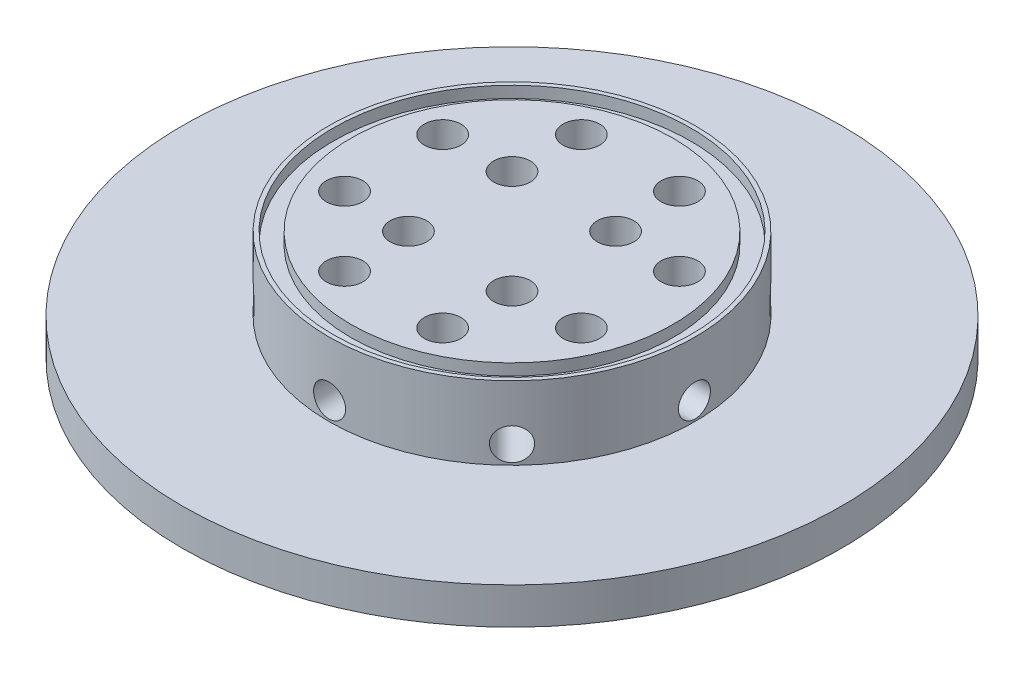
from build123d import *

# Parameters (mm, degrees)
CIRPATTERN1_COUNT = 8
CIRPATTERN2_COUNT = 4
CIRPATTERN4_COUNT = 4
CIRPATTERN6_COUNT = 8


with BuildPart() as part:
    # Sketch1 → Revolve1 (revolve)
    with BuildSketch(Plane.XY, mode=Mode.PRIVATE) as revolve1_sk:
        Polygon((0, 0), (-51.6509, 0), (-51.6509, 2.6924), (-55.7149, 2.6924), (-55.7149, 0), (-57.15, 0), (-57.15, 6.35), (-31.75, 6.35), (-31.75, 19.05), (-31.0261, 19.05), (-31.0261, 17.0688), (-27.9527, 17.0688), (-27.9527, 19.05), (0, 19.05), align=None)
    revolve(revolve1_sk.sketch.rotate(Axis((0, 19.05, 0), (0, -1, 0)), 270), axis=Axis((0, 19.05, 0), (0, -1, 0)))

    # Sketch5 → 1/4 (0.25) Diameter Hole3 (revolve, cut)
    with BuildSketch(Plane(origin=(-8.980256121, 19.05, 8.980256121), x_dir=(0, 0, 1), z_dir=(1, 0, 0))):
        Polygon((0, 0), (0, 14.607732465), (3.175, 12.7), (3.175, 0), align=None)
    f_1_4_0_25_diameter_hole3 = revolve(axis=Axis((-8.980256121, 25.4, 8.980256121), (0, -1, 0)), mode=Mode.SUBTRACT)

    # Sketch15 → 1/4 (0.25) Diameter Hole8 (revolve, cut)
    with BuildSketch(Plane(origin=(-20.53322261, 19.05, 8.505139284), x_dir=(0, 0, 1), z_dir=(1, 0, 0))):
        Polygon((0, 0), (0, 14.607732465), (3.175, 12.7), (3.175, 0), align=None)
    f_1_4_0_25_diameter_hole8 = revolve(axis=Axis((-20.53322261, 25.4, 8.505139284), (0, -1, 0)), mode=Mode.SUBTRACT)

    # CirPattern1: 1/4 (0.25) Diameter Hole8 ×8 about axis
    cirpattern1_axis = Axis((0, 0, 0), (0, 1, 0))
    for i in range(1, CIRPATTERN1_COUNT):
        add(f_1_4_0_25_diameter_hole8.rotate(cirpattern1_axis, i * 360 / CIRPATTERN1_COUNT), mode=Mode.SUBTRACT)

    # CirPattern2: 1/4 (0.25) Diameter Hole3 ×4 about axis
    cirpattern2_axis = Axis((0, 0, 0), (0, 1, 0))
    for i in range(1, CIRPATTERN2_COUNT):
        add(f_1_4_0_25_diameter_hole3.rotate(cirpattern2_axis, i * 360 / CIRPATTERN2_COUNT), mode=Mode.SUBTRACT)

    # Sketch21 → 7/32 (0.21875) Diameter Hole1 (revolve, cut)
    with BuildSketch(Plane(origin=(-57.15, 9.525, 0), x_dir=(0, 0, 1), z_dir=(0, 1, 0))):
        Polygon((0, 0), (0, 39.769265907), (2.778125, 38.1), (2.778125, 0), align=None)
    f_7_32_0_21875_diameter_hole1 = revolve(axis=Axis((-63.5, 9.525, 0), (1, 0, 0)), mode=Mode.SUBTRACT)

    # Sketch13 → 11/64 (0.17188) Diameter Hole1 (revolve, cut)
    with BuildSketch(Plane(origin=(-57.15, 9.525, 0), x_dir=(0, 0, 1), z_dir=(0, 1, 0))):
        Polygon((0, 0), (0, 52.111604225), (2.182876, 50.8), (2.182876, 0), align=None)
    f_11_64_0_17188_diameter_hole1 = revolve(axis=Axis((-63.5, 9.525, 0), (1, 0, 0)), mode=Mode.SUBTRACT)

    # CirPattern4: 11/64 (0.17188) Diameter Hole1 ×4 about axis
    cirpattern4_axis = Axis((0, 19.05, 0), (0, 1, 0))
    for i in range(1, CIRPATTERN4_COUNT):
        add(f_11_64_0_17188_diameter_hole1.rotate(cirpattern4_axis, i * 360 / CIRPATTERN4_COUNT), mode=Mode.SUBTRACT)

    # CirPattern6: 7/32 (0.21875) Diameter Hole1 ×8 about axis
    cirpattern6_axis = Axis((0, 19.05, 0), (0, 1, 0))
    for i in range(1, CIRPATTERN6_COUNT):
        add(f_7_32_0_21875_diameter_hole1.rotate(cirpattern6_axis, i * 360 / CIRPATTERN6_COUNT), mode=Mode.SUBTRACT)

    # Sketch29 → 1/32 (0.03125) Diameter Hole2 (revolve, cut)
    with BuildSketch(Plane(origin=(20.53322261, 0, 0), x_dir=(0, 0, -1), z_dir=(1, 0, 0))):
        Polygon((0, 0), (0, 9.763466558), (0.396875, 9.525), (0.396875, 0), align=None)
    revolve(axis=Axis((20.53322261, -6.35, 0), (0, 1, 0)), mode=Mode.SUBTRACT)

    # Sketch33 → 1/32 (0.03125) Diameter Hole3 (revolve, cut)
    with BuildSketch(Plane(origin=(8.980256121, 0, 0), x_dir=(0, 0, -1), z_dir=(1, 0, 0))):
        Polygon((0, 0), (0, 9.890466558), (0.396875, 9.652), (0.396875, 0), align=None)
    revolve(axis=Axis((8.980256121, -6.35, 0), (0, 1, 0)), mode=Mode.SUBTRACT)

    # Sketch40 → 1/32 (0.03125) Diameter Hole5 (revolve, cut)
    with BuildSketch(Plane(origin=(20.53322261, -3.175, 0), x_dir=(0, -0.6427876096865507, -0.7660444431189686), z_dir=(1, 0, 0))):
        Polygon((0, 0), (0, 12.938466558), (0.396875, 12.7), (0.396875, 0), align=None)
    f_1_32_0_03125_diameter_hole5 = revolve(axis=Axis((20.53322261, -8.039382214, 4.081701322), (0, 0.7660444431189686, -0.6427876096865507)), mode=Mode.SUBTRACT)

    # Mirror2: 1/32 (0.03125) Diameter Hole5 across plane
    add(f_1_32_0_03125_diameter_hole5.mirror(Plane.XY), mode=Mode.SUBTRACT)

    # CirPattern8: read off the stored shape, not the designer's step
    # CirPattern8: loft between two sections, ruled curve by curve
    cirpattern8_from = [
        Edge.make_three_point_arc((14.517742986, 6.775885368, 14.125777493), (14.914617986, 6.775885368, 14.522652493), (14.517742986, 6.775885368, 14.919527493)),
        Edge.make_three_point_arc((14.517742986, 6.775885368, 14.919527493), (14.120867986, 6.775885368, 14.522652493), (14.517742986, 6.775885368, 14.125777493)),
    ]
    cirpattern8_to = [
        Edge.make_three_point_arc((14.517742986, 0, 14.125777493), (14.914617986, 0, 14.522652493), (14.517742986, 0, 14.919527493)),
        Edge.make_three_point_arc((14.517742986, 0, 14.919527493), (14.120867986, 0, 14.522652493), (14.517742986, 0, 14.125777493)),
    ]
    cirpattern8 = Solid(Shell([*[Face.make_surface_from_curves(cirpattern8_from[k], cirpattern8_to[k]) for k in range(2)], Face(Wire(cirpattern8_from)), Face(Wire(cirpattern8_to))]))
    add(cirpattern8, mode=Mode.SUBTRACT)

    # CirPattern8 2: loft between two sections, ruled curve by curve
    cirpattern8_2_from = [
        Edge.make_three_point_arc((-0.004909507, 6.776086761, 20.141257117), (0.391965493, 6.776086761, 20.538132117), (-0.004909507, 6.776086761, 20.935007117)),
        Edge.make_three_point_arc((-0.004909507, 6.776086761, 20.935007117), (-0.401784507, 6.776086761, 20.538132117), (-0.004909507, 6.776086761, 20.141257117)),
    ]
    cirpattern8_2_to = [
        Edge.make_three_point_arc((-0.004909507, 0, 20.141257117), (0.391965493, 0, 20.538132117), (-0.004909507, 0, 20.935007117)),
        Edge.make_three_point_arc((-0.004909507, 0, 20.935007117), (-0.401784507, 0, 20.538132117), (-0.004909507, 0, 20.141257117)),
    ]
    cirpattern8_2 = Solid(Shell([*[Face.make_surface_from_curves(cirpattern8_2_from[k], cirpattern8_2_to[k]) for k in range(2)], Face(Wire(cirpattern8_2_from)), Face(Wire(cirpattern8_2_to))]))
    add(cirpattern8_2, mode=Mode.SUBTRACT)

    # CirPattern8 3: loft between two sections, ruled curve by curve
    cirpattern8_3_from = [
        Edge.make_three_point_arc((-14.527562, 6.775885353, 14.125777493), (-14.130687, 6.775885353, 14.522652493), (-14.527562, 6.775885353, 14.919527493)),
        Edge.make_three_point_arc((-14.527562, 6.775885353, 14.919527493), (-14.924437, 6.775885353, 14.522652493), (-14.527562, 6.775885353, 14.125777493)),
    ]
    cirpattern8_3_to = [
        Edge.make_three_point_arc((-14.527562, 0, 14.125777493), (-14.130687, 0, 14.522652493), (-14.527562, 0, 14.919527493)),
        Edge.make_three_point_arc((-14.527562, 0, 14.919527493), (-14.924437, 0, 14.522652493), (-14.527562, 0, 14.125777493)),
    ]
    cirpattern8_3 = Solid(Shell([*[Face.make_surface_from_curves(cirpattern8_3_from[k], cirpattern8_3_to[k]) for k in range(2)], Face(Wire(cirpattern8_3_from)), Face(Wire(cirpattern8_3_to))]))
    add(cirpattern8_3, mode=Mode.SUBTRACT)

    # CirPattern8 4: loft between two sections, ruled curve by curve
    cirpattern8_4_from = [
        Edge.make_three_point_arc((-20.543041624, 6.775384855, -0.396875), (-20.146166624, 6.775384855, 0), (-20.543041624, 6.775384855, 0.396875)),
        Edge.make_three_point_arc((-20.543041624, 6.775384855, 0.396875), (-20.939916624, 6.775384855, 0), (-20.543041624, 6.775384855, -0.396875)),
    ]
    cirpattern8_4_to = [
        Edge.make_three_point_arc((-20.543041624, 0, -0.396875), (-20.146166624, 0, 0), (-20.543041624, 0, 0.396875)),
        Edge.make_three_point_arc((-20.543041624, 0, 0.396875), (-20.939916624, 0, 0), (-20.543041624, 0, -0.396875)),
    ]
    cirpattern8_4 = Solid(Shell([*[Face.make_surface_from_curves(cirpattern8_4_from[k], cirpattern8_4_to[k]) for k in range(2)], Face(Wire(cirpattern8_4_from)), Face(Wire(cirpattern8_4_to))]))
    add(cirpattern8_4, mode=Mode.SUBTRACT)

    # CirPattern8 5: loft between two sections, ruled curve by curve
    cirpattern8_5_from = [
        Edge.make_three_point_arc((-14.527562, 6.775885368, -14.919527493), (-14.130687, 6.775885368, -14.522652493), (-14.527562, 6.775885368, -14.125777493)),
        Edge.make_three_point_arc((-14.527562, 6.775885368, -14.125777493), (-14.924437, 6.775885368, -14.522652493), (-14.527562, 6.775885368, -14.919527493)),
    ]
    cirpattern8_5_to = [
        Edge.make_three_point_arc((-14.527562, 0, -14.919527493), (-14.130687, 0, -14.522652493), (-14.527562, 0, -14.125777493)),
        Edge.make_three_point_arc((-14.527562, 0, -14.125777493), (-14.924437, 0, -14.522652493), (-14.527562, 0, -14.919527493)),
    ]
    cirpattern8_5 = Solid(Shell([*[Face.make_surface_from_curves(cirpattern8_5_from[k], cirpattern8_5_to[k]) for k in range(2)], Face(Wire(cirpattern8_5_from)), Face(Wire(cirpattern8_5_to))]))
    add(cirpattern8_5, mode=Mode.SUBTRACT)

    # CirPattern8 6: loft between two sections, ruled curve by curve
    cirpattern8_6_from = [
        Edge.make_three_point_arc((-0.004909507, 6.776086761, -20.935007117), (0.391965493, 6.776086761, -20.538132117), (-0.004909507, 6.776086761, -20.141257117)),
        Edge.make_three_point_arc((-0.004909507, 6.776086761, -20.141257117), (-0.401784507, 6.776086761, -20.538132117), (-0.004909507, 6.776086761, -20.935007117)),
    ]
    cirpattern8_6_to = [
        Edge.make_three_point_arc((-0.004909507, 0, -20.935007117), (0.391965493, 0, -20.538132117), (-0.004909507, 0, -20.141257117)),
        Edge.make_three_point_arc((-0.004909507, 0, -20.141257117), (-0.401784507, 0, -20.538132117), (-0.004909507, 0, -20.935007117)),
    ]
    cirpattern8_6 = Solid(Shell([*[Face.make_surface_from_curves(cirpattern8_6_from[k], cirpattern8_6_to[k]) for k in range(2)], Face(Wire(cirpattern8_6_from)), Face(Wire(cirpattern8_6_to))]))
    add(cirpattern8_6, mode=Mode.SUBTRACT)

    # CirPattern8 7: loft between two sections, ruled curve by curve
    cirpattern8_7_from = [
        Edge.make_three_point_arc((14.517742986, 6.775885353, -14.919527493), (14.914617986, 6.775885353, -14.522652493), (14.517742986, 6.775885353, -14.125777493)),
        Edge.make_three_point_arc((14.517742986, 6.775885353, -14.125777493), (14.120867986, 6.775885353, -14.522652493), (14.517742986, 6.775885353, -14.919527493)),
    ]
    cirpattern8_7_to = [
        Edge.make_three_point_arc((14.517742986, 0, -14.919527493), (14.914617986, 0, -14.522652493), (14.517742986, 0, -14.125777493)),
        Edge.make_three_point_arc((14.517742986, 0, -14.125777493), (14.120867986, 0, -14.522652493), (14.517742986, 0, -14.919527493)),
    ]
    cirpattern8_7 = Solid(Shell([*[Face.make_surface_from_curves(cirpattern8_7_from[k], cirpattern8_7_to[k]) for k in range(2)], Face(Wire(cirpattern8_7_from)), Face(Wire(cirpattern8_7_to))]))
    add(cirpattern8_7, mode=Mode.SUBTRACT)

    # CirPattern8 8: loft between two sections, ruled curve by curve
    cirpattern8_8_from = [
        Edge.make_three_point_arc((9.684186011, 5.589475263, 19.355706854), (9.749841661, 5.334368931, 19.851317211), (9.254231305, 5.079262598, 19.78566156)),
        Edge.make_three_point_arc((9.254231305, 5.079262598, 19.78566156), (9.188575654, 5.334368931, 19.290051203), (9.684186011, 5.589475263, 19.355706854)),
    ]
    cirpattern8_8_to = [
        Edge.make_three_point_arc((13.000684672, -0.000131992, 16.039208193), (13.066340323, -0.255238325, 16.53481855), (12.570729966, -0.510344657, 16.469162899)),
        Edge.make_three_point_arc((12.570729966, -0.510344657, 16.469162899), (12.505074315, -0.255238325, 15.973552542), (13.000684672, -0.000131992, 16.039208193)),
    ]
    cirpattern8_8 = Solid(Shell([*[Face.make_surface_from_curves(cirpattern8_8_from[k], cirpattern8_8_to[k]) for k in range(2)], Face(Wire(cirpattern8_8_from)), Face(Wire(cirpattern8_8_to))]))
    add(cirpattern8_8, mode=Mode.SUBTRACT)

    # CirPattern8 9: loft between two sections, ruled curve by curve
    cirpattern8_9_from = [
        Edge.make_three_point_arc((-6.839672165, 5.589226941, 20.536918699), (-7.143696054, 5.334120609, 20.933793699), (-7.447719942, 5.079014276, 20.536918699)),
        Edge.make_three_point_arc((-7.447719942, 5.079014276, 20.536918699), (-7.143696054, 5.334120609, 20.140043699), (-6.839672165, 5.589226941, 20.536918699)),
    ]
    cirpattern8_9_to = [
        Edge.make_three_point_arc((-2.149643146, -0.000131992, 20.536918699), (-2.453667034, -0.255238325, 20.933793699), (-2.757690922, -0.510344657, 20.536918699)),
        Edge.make_three_point_arc((-2.757690922, -0.510344657, 20.536918699), (-2.453667034, -0.255238325, 20.140043699), (-2.149643146, -0.000131992, 20.536918699)),
    ]
    cirpattern8_9 = Solid(Shell([*[Face.make_surface_from_curves(cirpattern8_9_from[k], cirpattern8_9_to[k]) for k in range(2)], Face(Wire(cirpattern8_9_from)), Face(Wire(cirpattern8_9_to))]))
    add(cirpattern8_9, mode=Mode.SUBTRACT)

    # CirPattern8 10: loft between two sections, ruled curve by curve
    cirpattern8_10_from = [
        Edge.make_three_point_arc((-19.78913645, 5.079637066, 9.257262739), (-19.293630335, 5.335145719, 9.192389399), (-19.360068133, 5.589849095, 9.688102764)),
        Edge.make_three_point_arc((-19.360068133, 5.589849095, 9.688102764), (-19.855574248, 5.334340443, 9.752976104), (-19.78913645, 5.079637066, 9.257262739)),
    ]
    cirpattern8_10_to = [
        Edge.make_three_point_arc((-16.472415793, -0.510344339, 12.573983395), (-15.976909679, -0.254835687, 12.509110056), (-16.043347477, -0.00013231, 13.00482342)),
        Edge.make_three_point_arc((-16.043347477, -0.00013231, 13.00482342), (-16.538853591, -0.255640963, 13.06969676), (-16.472415793, -0.510344339, 12.573983395)),
    ]
    cirpattern8_10 = Solid(Shell([*[Face.make_surface_from_curves(cirpattern8_10_from[k], cirpattern8_10_to[k]) for k in range(2)], Face(Wire(cirpattern8_10_from)), Face(Wire(cirpattern8_10_to))]))
    add(cirpattern8_10, mode=Mode.SUBTRACT)

    # CirPattern8 11: loft between two sections, ruled curve by curve
    cirpattern8_11_from = [
        Edge.make_three_point_arc((-20.533222591, 5.080790438, -7.445424353), (-20.143808638, 5.340604127, -7.135790455), (-20.548006985, 5.590914592, -6.83748206)),
        Edge.make_three_point_arc((-20.548006985, 5.590914592, -6.83748206), (-20.937420939, 5.331100902, -7.147115958), (-20.533222591, 5.080790438, -7.445424353)),
    ]
    cirpattern8_11_to = [
        Edge.make_three_point_arc((-20.533222591, -0.510300402, -2.753942092), (-20.143808638, -0.250486712, -2.444308193), (-20.548006985, -0.000176248, -2.145999798)),
        Edge.make_three_point_arc((-20.548006985, -0.000176248, -2.145999798), (-20.937420939, -0.259989937, -2.455633696), (-20.533222591, -0.510300402, -2.753942092)),
    ]
    cirpattern8_11 = Solid(Shell([*[Face.make_surface_from_curves(cirpattern8_11_from[k], cirpattern8_11_to[k]) for k in range(2)], Face(Wire(cirpattern8_11_from)), Face(Wire(cirpattern8_11_to))]))
    add(cirpattern8_11, mode=Mode.SUBTRACT)

    # CirPattern8 12: loft between two sections, ruled curve by curve
    cirpattern8_12_from = [
        Edge.make_three_point_arc((-9.767955744, 5.351825661, -19.839621896), (-9.277070043, 5.082143787, -19.803256433), (-9.18235194, 5.32178971, -19.304640506)),
        Edge.make_three_point_arc((-9.18235194, 5.32178971, -19.304640506), (-9.67323764, 5.591471584, -19.341005968), (-9.767955744, 5.351825661, -19.839621896)),
    ]
    cirpattern8_12_to = [
        Edge.make_three_point_arc((-13.085901399, -0.240220349, -16.521676241), (-12.595015699, -0.509902223, -16.485310778), (-12.500297595, -0.2702563, -15.98669485)),
        Edge.make_three_point_arc((-12.500297595, -0.2702563, -15.98669485), (-12.991183295, -0.000574426, -16.023060313), (-13.085901399, -0.240220349, -16.521676241)),
    ]
    cirpattern8_12 = Solid(Shell([*[Face.make_surface_from_curves(cirpattern8_12_from[k], cirpattern8_12_to[k]) for k in range(2)], Face(Wire(cirpattern8_12_from)), Face(Wire(cirpattern8_12_to))]))
    add(cirpattern8_12, mode=Mode.SUBTRACT)

    # CirPattern8 13: loft between two sections, ruled curve by curve
    cirpattern8_13_from = [
        Edge.make_three_point_arc((6.859631941, 5.571258904, -20.694215889), (7.259254151, 5.235936055, -20.901291255), (7.417883085, 5.102830576, -20.379621509)),
        Edge.make_three_point_arc((7.417883085, 5.102830576, -20.379621509), (7.018260874, 5.438153425, -20.172546143), (6.859631941, 5.571258904, -20.694215889)),
    ]
    cirpattern8_13_to = [
        Edge.make_three_point_arc((2.167149284, -0.02102416, -20.694215889), (2.566771494, -0.35634701, -20.901291255), (2.725400428, -0.489452489, -20.379621509)),
        Edge.make_three_point_arc((2.725400428, -0.489452489, -20.379621509), (2.325778217, -0.15412964, -20.172546143), (2.167149284, -0.02102416, -20.694215889)),
    ]
    cirpattern8_13 = Solid(Shell([*[Face.make_surface_from_curves(cirpattern8_13_from[k], cirpattern8_13_to[k]) for k in range(2)], Face(Wire(cirpattern8_13_from)), Face(Wire(cirpattern8_13_to))]))
    add(cirpattern8_13, mode=Mode.SUBTRACT)

    # CirPattern8 14: loft between two sections, ruled curve by curve
    cirpattern8_14_from = [
        Edge.make_three_point_arc((19.353237318, 5.591542488, -9.686655547), (19.848847674, 5.336436156, -9.752311198), (19.783192024, 5.081329823, -9.256700841)),
        Edge.make_three_point_arc((19.783192024, 5.081329823, -9.256700841), (19.287581667, 5.336436156, -9.19104519), (19.353237318, 5.591542488, -9.686655547)),
    ]
    cirpattern8_14_to = [
        Edge.make_three_point_arc((16.035512104, -0.000131992, -13.004380761), (16.53112246, -0.255238325, -13.070036412), (16.46546681, -0.510344657, -12.574426055)),
        Edge.make_three_point_arc((16.46546681, -0.510344657, -12.574426055), (15.969856453, -0.255238325, -12.508770404), (16.035512104, -0.000131992, -13.004380761)),
    ]
    cirpattern8_14 = Solid(Shell([*[Face.make_surface_from_curves(cirpattern8_14_from[k], cirpattern8_14_to[k]) for k in range(2)], Face(Wire(cirpattern8_14_from)), Face(Wire(cirpattern8_14_to))]))
    add(cirpattern8_14, mode=Mode.SUBTRACT)

    # CirPattern8 15: loft between two sections, ruled curve by curve
    cirpattern8_15_from = [
        Edge.make_three_point_arc((19.275518394, 5.35124027, 9.203666963), (19.766301462, 5.081299609, 9.239493637), (19.861549926, 5.320653994, 9.738148567)),
        Edge.make_three_point_arc((19.861549926, 5.320653994, 9.738148567), (19.370766858, 5.590594654, 9.702321894), (19.275518394, 5.35124027, 9.203666963)),
    ]
    cirpattern8_15_to = [
        Edge.make_three_point_arc((15.958083334, -0.239945187, 12.521102023), (16.448866402, -0.509885847, 12.556928697), (16.544114866, -0.270531463, 13.055583627)),
        Edge.make_three_point_arc((16.544114866, -0.270531463, 13.055583627), (16.053331798, -0.000590802, 13.019756954), (15.958083334, -0.239945187, 12.521102023)),
    ]
    cirpattern8_15 = Solid(Shell([*[Face.make_surface_from_curves(cirpattern8_15_from[k], cirpattern8_15_to[k]) for k in range(2)], Face(Wire(cirpattern8_15_from)), Face(Wire(cirpattern8_15_to))]))
    add(cirpattern8_15, mode=Mode.SUBTRACT)

    # CirPattern8 16: loft between two sections, ruled curve by curve
    cirpattern8_16_from = [
        Edge.make_three_point_arc((6.860705201, 5.570488792, 20.378368488), (7.260272353, 5.235212142, 20.171112148), (7.419039921, 5.101990335, 20.692710021)),
        Edge.make_three_point_arc((7.419039921, 5.101990335, 20.692710021), (7.019472769, 5.437266985, 20.89996636), (6.860705201, 5.570488792, 20.378368488)),
    ]
    cirpattern8_16_to = [
        Edge.make_three_point_arc((2.168898168, -0.020989096, 20.378368488), (2.56846532, -0.356265746, 20.171112148), (2.727232887, -0.489487553, 20.692710021)),
        Edge.make_three_point_arc((2.727232887, -0.489487553, 20.692710021), (2.327665735, -0.154210903, 20.89996636), (2.168898168, -0.020989096, 20.378368488)),
    ]
    cirpattern8_16 = Solid(Shell([*[Face.make_surface_from_curves(cirpattern8_16_from[k], cirpattern8_16_to[k]) for k in range(2)], Face(Wire(cirpattern8_16_from)), Face(Wire(cirpattern8_16_to))]))
    add(cirpattern8_16, mode=Mode.SUBTRACT)

    # CirPattern8 17: loft between two sections, ruled curve by curve
    cirpattern8_17_from = [
        Edge.make_three_point_arc((-9.686002719, 5.59114085, 19.354203239), (-9.190806281, 5.334467618, 19.291602351), (-9.259514202, 5.080937869, 19.787607814)),
        Edge.make_three_point_arc((-9.259514202, 5.080937869, 19.787607814), (-9.75471064, 5.337611102, 19.850208701), (-9.686002719, 5.59114085, 19.354203239)),
    ]
    cirpattern8_17_to = [
        Edge.make_three_point_arc((-13.003492501, -0.000136834, 16.036713456), (-12.508296063, -0.256810066, 15.974112569), (-12.577003985, -0.510339815, 16.470118032)),
        Edge.make_three_point_arc((-12.577003985, -0.510339815, 16.470118032), (-13.072200422, -0.253666583, 16.532718919), (-13.003492501, -0.000136834, 16.036713456)),
    ]
    cirpattern8_17 = Solid(Shell([*[Face.make_surface_from_curves(cirpattern8_17_from[k], cirpattern8_17_to[k]) for k in range(2)], Face(Wire(cirpattern8_17_from)), Face(Wire(cirpattern8_17_to))]))
    add(cirpattern8_17, mode=Mode.SUBTRACT)

    # CirPattern8 18: loft between two sections, ruled curve by curve
    cirpattern8_18_from = [
        Edge.make_three_point_arc((-20.537444672, 5.590564012, 6.837509238), (-20.140569672, 5.335457679, 7.141533127), (-20.537444672, 5.080351347, 7.445557015)),
        Edge.make_three_point_arc((-20.537444672, 5.080351347, 7.445557015), (-20.934319672, 5.335457679, 7.141533127), (-20.537444672, 5.590564012, 6.837509238)),
    ]
    cirpattern8_18_to = [
        Edge.make_three_point_arc((-20.537444672, -0.000131992, 2.146358283), (-20.140569672, -0.255238325, 2.450382172), (-20.537444672, -0.510344657, 2.75440606)),
        Edge.make_three_point_arc((-20.537444672, -0.510344657, 2.75440606), (-20.934319672, -0.255238325, 2.450382172), (-20.537444672, -0.000131992, 2.146358283)),
    ]
    cirpattern8_18 = Solid(Shell([*[Face.make_surface_from_curves(cirpattern8_18_from[k], cirpattern8_18_to[k]) for k in range(2)], Face(Wire(cirpattern8_18_from)), Face(Wire(cirpattern8_18_to))]))
    add(cirpattern8_18, mode=Mode.SUBTRACT)

    # CirPattern8 19: loft between two sections, ruled curve by curve
    cirpattern8_19_from = [
        Edge.make_three_point_arc((-19.357120762, 5.589944295, -9.686131998), (-19.291465111, 5.334837963, -9.190521641), (-19.787075468, 5.07973163, -9.256177292)),
        Edge.make_three_point_arc((-19.787075468, 5.07973163, -9.256177292), (-19.852731119, 5.334837963, -9.751787649), (-19.357120762, 5.589944295, -9.686131998)),
    ]
    cirpattern8_19_to = [
        Edge.make_three_point_arc((-16.040343808, -0.000131992, -13.002908952), (-15.974688158, -0.255238325, -12.507298595), (-16.470298515, -0.510344657, -12.572954245)),
        Edge.make_three_point_arc((-16.470298515, -0.510344657, -12.572954245), (-16.535954165, -0.255238325, -13.068564602), (-16.040343808, -0.000131992, -13.002908952)),
    ]
    cirpattern8_19 = Solid(Shell([*[Face.make_surface_from_curves(cirpattern8_19_from[k], cirpattern8_19_to[k]) for k in range(2)], Face(Wire(cirpattern8_19_from)), Face(Wire(cirpattern8_19_to))]))
    add(cirpattern8_19, mode=Mode.SUBTRACT)

    # CirPattern8 20: loft between two sections, ruled curve by curve
    cirpattern8_20_from = [
        Edge.make_three_point_arc((-6.838647048, 5.589649213, -20.535128027), (-7.142670936, 5.33454288, -20.138253027), (-7.446694825, 5.079436547, -20.535128027)),
        Edge.make_three_point_arc((-7.446694825, 5.079436547, -20.535128027), (-7.142670936, 5.33454288, -20.932003027), (-6.838647048, 5.589649213, -20.535128027)),
    ]
    cirpattern8_20_to = [
        Edge.make_three_point_arc((-2.148263701, -0.000131992, -20.535128027), (-2.452287589, -0.255238325, -20.138253027), (-2.756311477, -0.510344657, -20.535128027)),
        Edge.make_three_point_arc((-2.756311477, -0.510344657, -20.535128027), (-2.452287589, -0.255238325, -20.932003027), (-2.148263701, -0.000131992, -20.535128027)),
    ]
    cirpattern8_20 = Solid(Shell([*[Face.make_surface_from_curves(cirpattern8_20_from[k], cirpattern8_20_to[k]) for k in range(2)], Face(Wire(cirpattern8_20_from)), Face(Wire(cirpattern8_20_to))]))
    add(cirpattern8_20, mode=Mode.SUBTRACT)

    # CirPattern8 21: loft between two sections, ruled curve by curve
    cirpattern8_21_from = [
        Edge.make_three_point_arc((9.254292921, 5.079640091, -19.784671239), (9.749911058, 5.334716179, -19.850385644), (9.684314163, 5.589852753, -19.354783075)),
        Edge.make_three_point_arc((9.684314163, 5.589852753, -19.354783075), (9.188696026, 5.334776665, -19.289068669), (9.254292921, 5.079640091, -19.784671239)),
    ]
    cirpattern8_21_to = [
        Edge.make_three_point_arc((12.57101556, -0.510344655, -16.4679486), (13.066633697, -0.255268568, -16.533663005), (13.001036802, -0.000131994, -16.038060435)),
        Edge.make_three_point_arc((13.001036802, -0.000131994, -16.038060435), (12.505418665, -0.255208082, -15.97234603), (12.57101556, -0.510344655, -16.4679486)),
    ]
    cirpattern8_21 = Solid(Shell([*[Face.make_surface_from_curves(cirpattern8_21_from[k], cirpattern8_21_to[k]) for k in range(2)], Face(Wire(cirpattern8_21_from)), Face(Wire(cirpattern8_21_to))]))
    add(cirpattern8_21, mode=Mode.SUBTRACT)

    # Sketch43 → 1/32 (0.03125) Diameter Hole6 (revolve, cut)
    with BuildSketch(Plane(origin=(8.980256121, -3.175, 0), x_dir=(0, -0.5735764363510585, -0.8191520442889831), z_dir=(1, 0, 0))):
        Polygon((0, 0), (0, 12.938466558), (0.396875, 12.7), (0.396875, 0), align=None)
    f_1_32_0_03125_diameter_hole6 = revolve(axis=Axis((8.980256121, -8.376615481, 3.642210371), (0, 0.8191520442889832, -0.5735764363510585)), mode=Mode.SUBTRACT)

    # Mirror3: 1/32 (0.03125) Diameter Hole6 across plane
    add(f_1_32_0_03125_diameter_hole6.mirror(Plane.XY), mode=Mode.SUBTRACT)

    # CirPattern9: read off the stored shape, not the designer's step
    # CirPattern9: loft between two sections, ruled curve by curve
    cirpattern9_from = [
        Edge.make_three_point_arc((-0.001822199, 7.378848939, 8.585203066), (0.395052801, 7.378848939, 8.982078066), (-0.001822199, 7.378848939, 9.378953066)),
        Edge.make_three_point_arc((-0.001822199, 7.378848939, 9.378953066), (-0.398697199, 7.378848939, 8.982078066), (-0.001822199, 7.378848939, 8.585203066)),
    ]
    cirpattern9_to = [
        Edge.make_three_point_arc((-0.001822199, 0, 8.585203066), (0.395052801, 0, 8.982078066), (-0.001822199, 0, 9.378953066)),
        Edge.make_three_point_arc((-0.001822199, 0, 9.378953066), (-0.398697199, 0, 8.982078066), (-0.001822199, 0, 8.585203066)),
    ]
    cirpattern9 = Solid(Shell([*[Face.make_surface_from_curves(cirpattern9_from[k], cirpattern9_to[k]) for k in range(2)], Face(Wire(cirpattern9_from)), Face(Wire(cirpattern9_to))]))
    add(cirpattern9, mode=Mode.SUBTRACT)

    # CirPattern9 2: loft between two sections, ruled curve by curve
    cirpattern9_2_from = [
        Edge.make_three_point_arc((-8.983900264, 7.378525626, -0.396875254), (-8.587025264, 7.378525626, -2.54e-07), (-8.983900264, 7.378525626, 0.396874746)),
        Edge.make_three_point_arc((-8.983900264, 7.378525626, 0.396874746), (-9.380775264, 7.378525626, -2.54e-07), (-8.983900264, 7.378525626, -0.396875254)),
    ]
    cirpattern9_2_to = [
        Edge.make_three_point_arc((-8.983900264, 0, -0.396875254), (-8.587025264, 0, -2.54e-07), (-8.983900264, 0, 0.396874746)),
        Edge.make_three_point_arc((-8.983900264, 0, 0.396874746), (-9.380775264, 0, -2.54e-07), (-8.983900264, 0, -0.396875254)),
    ]
    cirpattern9_2 = Solid(Shell([*[Face.make_surface_from_curves(cirpattern9_2_from[k], cirpattern9_2_to[k]) for k in range(2)], Face(Wire(cirpattern9_2_from)), Face(Wire(cirpattern9_2_to))]))
    add(cirpattern9_2, mode=Mode.SUBTRACT)

    # CirPattern9 3: loft between two sections, ruled curve by curve
    cirpattern9_3_from = [
        Edge.make_three_point_arc((-0.001821945, 7.378848892, -9.37895332), (0.395053055, 7.378848892, -8.98207832), (-0.001821945, 7.378848892, -8.58520332)),
        Edge.make_three_point_arc((-0.001821945, 7.378848892, -8.58520332), (-0.398696945, 7.378848892, -8.98207832), (-0.001821945, 7.378848892, -9.37895332)),
    ]
    cirpattern9_3_to = [
        Edge.make_three_point_arc((-0.001821945, 0, -9.37895332), (0.395053055, 0, -8.98207832), (-0.001821945, 0, -8.58520332)),
        Edge.make_three_point_arc((-0.001821945, 0, -8.58520332), (-0.398696945, 0, -8.98207832), (-0.001821945, 0, -9.37895332)),
    ]
    cirpattern9_3 = Solid(Shell([*[Face.make_surface_from_curves(cirpattern9_3_from[k], cirpattern9_3_to[k]) for k in range(2)], Face(Wire(cirpattern9_3_from)), Face(Wire(cirpattern9_3_to))]))
    add(cirpattern9_3, mode=Mode.SUBTRACT)

    # CirPattern9 4: loft between two sections, ruled curve by curve
    cirpattern9_4_from = [
        Edge.make_three_point_arc((-6.105791087, 6.23506039, 8.981546649), (-6.430892054, 6.007422241, 9.378421649), (-6.755993022, 5.779784093, 8.981546649)),
        Edge.make_three_point_arc((-6.755993022, 5.779784093, 8.981546649), (-6.430892054, 6.007422241, 8.584671649), (-6.105791087, 6.23506039, 8.981546649)),
    ]
    cirpattern9_4_to = [
        Edge.make_three_point_arc((-1.73987233, -0.00011778, 8.981546649), (-2.064973298, -0.227755928, 9.378421649), (-2.390074265, -0.455394076, 8.981546649)),
        Edge.make_three_point_arc((-2.390074265, -0.455394076, 8.981546649), (-2.064973298, -0.227755928, 8.584671649), (-1.73987233, -0.00011778, 8.981546649)),
    ]
    cirpattern9_4 = Solid(Shell([*[Face.make_surface_from_curves(cirpattern9_4_from[k], cirpattern9_4_to[k]) for k in range(2)], Face(Wire(cirpattern9_4_from)), Face(Wire(cirpattern9_4_to))]))
    add(cirpattern9_4, mode=Mode.SUBTRACT)

    # CirPattern9 5: loft between two sections, ruled curve by curve
    cirpattern9_5_from = [
        Edge.make_three_point_arc((-8.980256116, 5.780389213, -6.755115955), (-8.585970825, 6.009503127, -6.427907375), (-8.985418745, 6.235655879, -6.104927773)),
        Edge.make_three_point_arc((-8.985418745, 6.235655879, -6.104927773), (-9.379704036, 6.006541965, -6.432136353), (-8.980256116, 5.780389213, -6.755115955)),
    ]
    cirpattern9_5_to = [
        Edge.make_three_point_arc((-8.980256116, -0.455389261, -2.388776861), (-8.585970825, -0.226275347, -2.061568281), (-8.985418745, -0.000122595, -1.738588679)),
        Edge.make_three_point_arc((-8.985418745, -0.000122595, -1.738588679), (-9.379704036, -0.229236509, -2.065797259), (-8.980256116, -0.455389261, -2.388776861)),
    ]
    cirpattern9_5 = Solid(Shell([*[Face.make_surface_from_curves(cirpattern9_5_from[k], cirpattern9_5_to[k]) for k in range(2)], Face(Wire(cirpattern9_5_from)), Face(Wire(cirpattern9_5_to))]))
    add(cirpattern9_5, mode=Mode.SUBTRACT)

    # CirPattern9 6: loft between two sections, ruled curve by curve
    cirpattern9_6_from = [
        Edge.make_three_point_arc((6.651713414, 5.852615391, -9.27074859), (6.665972699, 5.842630932, -8.709752588), (6.206431677, 6.16440502, -8.692345215)),
        Edge.make_three_point_arc((6.206431677, 6.16440502, -8.692345215), (6.192172392, 6.174389479, -9.253341218), (6.651713414, 5.852615391, -9.27074859)),
    ]
    cirpattern9_6_to = [
        Edge.make_three_point_arc((2.285032857, -0.383650743, -9.27074859), (2.299292142, -0.393635201, -8.709752588), (1.83975112, -0.071861114, -8.692345215)),
        Edge.make_three_point_arc((1.83975112, -0.071861114, -8.692345215), (1.825491835, -0.061876655, -9.253341218), (2.285032857, -0.383650743, -9.27074859)),
    ]
    cirpattern9_6 = Solid(Shell([*[Face.make_surface_from_curves(cirpattern9_6_from[k], cirpattern9_6_to[k]) for k in range(2)], Face(Wire(cirpattern9_6_from)), Face(Wire(cirpattern9_6_to))]))
    add(cirpattern9_6, mode=Mode.SUBTRACT)

    # CirPattern9 7: loft between two sections, ruled curve by curve
    cirpattern9_7_from = [
        Edge.make_three_point_arc((6.65209103, 5.852377675, 8.691652966), (6.666695089, 5.842151803, 9.25263575), (6.207164895, 6.163918309, 9.270464015)),
        Edge.make_three_point_arc((6.207164895, 6.163918309, 9.270464015), (6.192560835, 6.174144182, 8.70948123), (6.65209103, 5.852377675, 8.691652966)),
    ]
    cirpattern9_7_to = [
        Edge.make_three_point_arc((2.285664097, -0.383526245, 8.691652966), (2.300268156, -0.393752117, 9.25263575), (1.840737962, -0.071985611, 9.270464015)),
        Edge.make_three_point_arc((1.840737962, -0.071985611, 9.270464015), (1.826133903, -0.061759739, 8.70948123), (2.285664097, -0.383526245, 8.691652966)),
    ]
    cirpattern9_7 = Solid(Shell([*[Face.make_surface_from_curves(cirpattern9_7_from[k], cirpattern9_7_to[k]) for k in range(2)], Face(Wire(cirpattern9_7_from)), Face(Wire(cirpattern9_7_to))]))
    add(cirpattern9_7, mode=Mode.SUBTRACT)

    # CirPattern9 8: loft between two sections, ruled curve by curve
    cirpattern9_8_from = [
        Edge.make_three_point_arc((-8.981539977, 6.235468806, 6.105107164), (-8.584664977, 6.007830658, 6.430208132), (-8.981539977, 5.78019251, 6.755309099)),
        Edge.make_three_point_arc((-8.981539977, 5.78019251, 6.755309099), (-9.378414977, 6.007830658, 6.430208132), (-8.981539977, 6.235468806, 6.105107164)),
    ]
    cirpattern9_8_to = [
        Edge.make_three_point_arc((-8.981539977, -0.00011778, 1.738902431), (-8.584664977, -0.227755928, 2.064003399), (-8.981539977, -0.455394076, 2.389104366)),
        Edge.make_three_point_arc((-8.981539977, -0.455394076, 2.389104366), (-9.378414977, -0.227755928, 2.064003399), (-8.981539977, -0.00011778, 1.738902431)),
    ]
    cirpattern9_8 = Solid(Shell([*[Face.make_surface_from_curves(cirpattern9_8_from[k], cirpattern9_8_to[k]) for k in range(2)], Face(Wire(cirpattern9_8_from)), Face(Wire(cirpattern9_8_to))]))
    add(cirpattern9_8, mode=Mode.SUBTRACT)

    # CirPattern9 9: loft between two sections, ruled curve by curve
    cirpattern9_9_from = [
        Edge.make_three_point_arc((-6.1054221, 6.235230948, -8.980737607), (-6.430523068, 6.0075928, -8.583862607), (-6.755624035, 5.779954651, -8.980737607)),
        Edge.make_three_point_arc((-6.755624035, 5.779954651, -8.980737607), (-6.430523068, 6.0075928, -9.377612607), (-6.1054221, 6.235230948, -8.980737607)),
    ]
    cirpattern9_9_to = [
        Edge.make_three_point_arc((-1.739383918, -0.00011778, -8.980737607), (-2.064484885, -0.227755928, -8.583862607), (-2.389585853, -0.455394076, -8.980737607)),
        Edge.make_three_point_arc((-2.389585853, -0.455394076, -8.980737607), (-2.064484885, -0.227755928, -9.377612607), (-1.739383918, -0.00011778, -8.980737607)),
    ]
    cirpattern9_9 = Solid(Shell([*[Face.make_surface_from_curves(cirpattern9_9_from[k], cirpattern9_9_to[k]) for k in range(2)], Face(Wire(cirpattern9_9_from)), Face(Wire(cirpattern9_9_to))]))
    add(cirpattern9_9, mode=Mode.SUBTRACT)


solid = part.part
